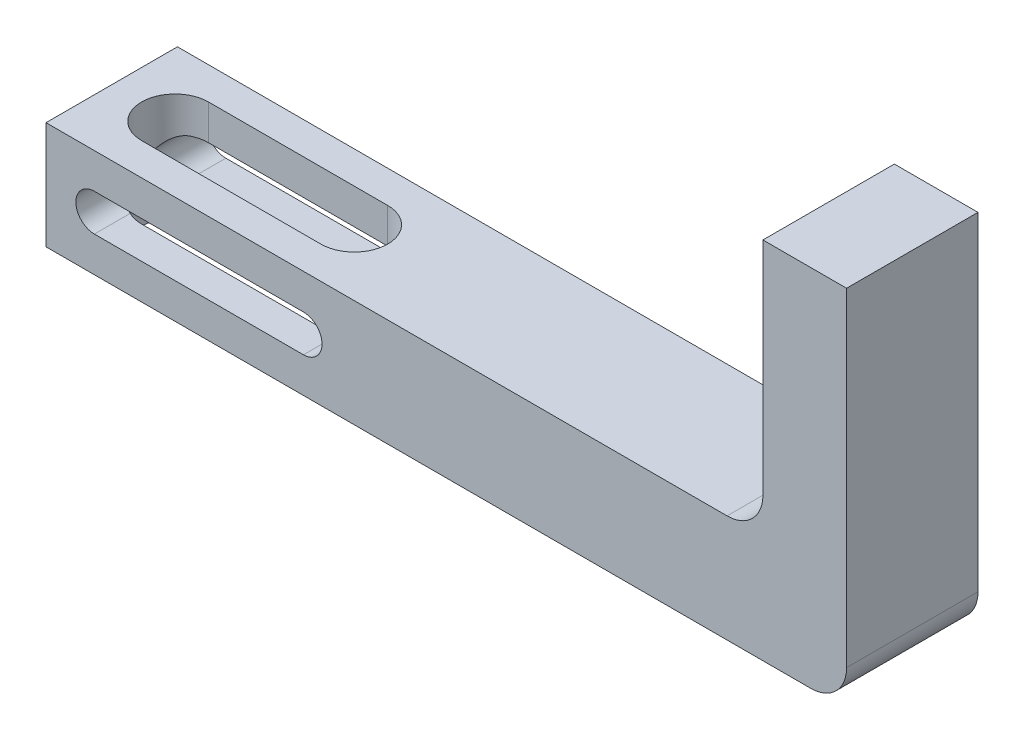
from build123d import *

# Parameters (mm, degrees)
BOSS_EXTRUDE1_DEPTH = 11
CUT_EXTRUDE1_DEPTH  = 75.432855649
CUT_EXTRUDE2_DEPTH  = 75.432855649
FILLET1_R           = 3


with BuildPart() as part:
    # Sketch1 → Boss-Extrude1 (new body)
    with BuildSketch(Plane.XY):
        Polygon((0, 0), (67, 0), (67, 30.5), (60, 30.5), (60, 9), (0, 9), align=None)
    extrude(amount=-BOSS_EXTRUDE1_DEPTH)

    # Sketch2 → Cut-Extrude1 (cut, through all)
    with BuildSketch(Plane.XZ):
        with BuildLine():
            Line((5.3, -2.7), (20.3, -2.7))
            ThreePointArc((20.3, -2.7), (23.1, -5.5), (20.3, -8.3))
            Line((20.3, -8.3), (5.3, -8.3))
            ThreePointArc((5.3, -8.3), (2.5, -5.5), (5.3, -2.7))
        make_face()
    extrude(amount=-CUT_EXTRUDE1_DEPTH, mode=Mode.SUBTRACT)

    # Sketch3 → Cut-Extrude2 (cut, through all)
    with BuildSketch(Plane.XY):
        with BuildLine():
            Line((4.05, 6.05), (21.55, 6.05))
            ThreePointArc((21.55, 6.05), (23.1, 4.5), (21.55, 2.95))
            Line((21.55, 2.95), (4.05, 2.95))
            ThreePointArc((4.05, 2.95), (2.5, 4.5), (4.05, 6.05))
        make_face()
    extrude(amount=-CUT_EXTRUDE2_DEPTH, mode=Mode.SUBTRACT)

    # Fillet1
    fillet1_edges = [part.edges().sort_by_distance(p)[0] for p in [
        (60, 9, -5.5),
        (67, 0, -5.5),
    ]]
    fillet(fillet1_edges, radius=FILLET1_R)


solid = part.part
